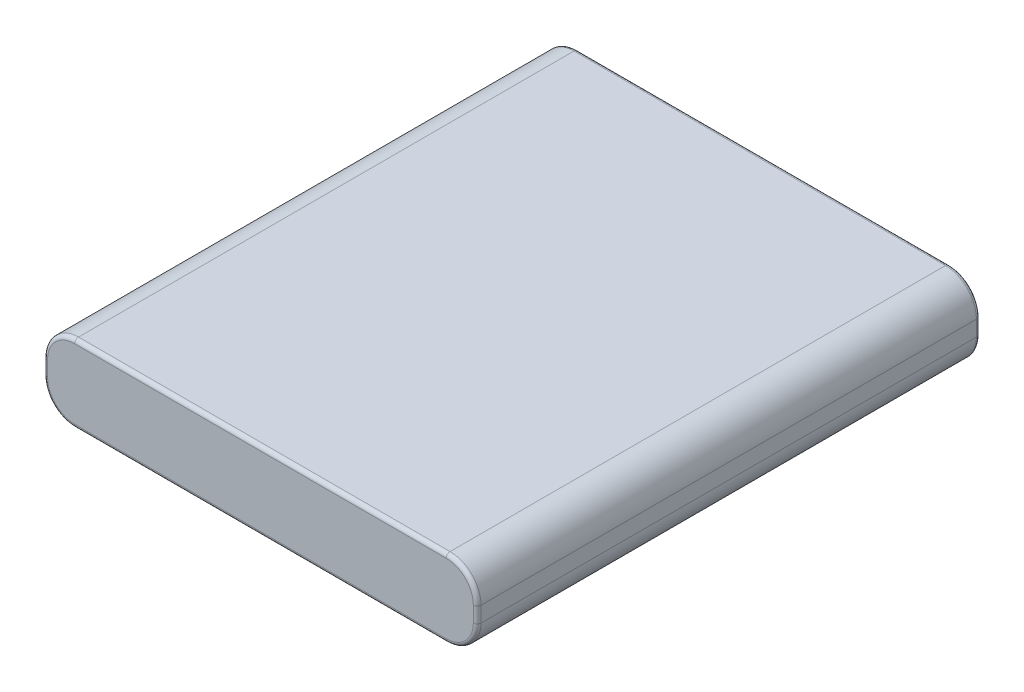
from build123d import *

# Parameters (mm, degrees)
SKETCH_1_W      = 56
SKETCH_1_H      = 65
EXTRUDE_1_DEPTH = 10
FILLET_1_R      = 4
FILLET_2_R      = 0.5
SKETCH_2_R      = 7
EXTRUDE_2_DEPTH = 2


with BuildPart() as part:
    # 草图1 → 凸台-拉伸1 (new body)
    with BuildSketch(Plane(origin=(0, 0, 0), x_dir=(1, 0, 0), z_dir=(0, 1, 0))):
        Rectangle(SKETCH_1_W, SKETCH_1_H)
    extrude(amount=EXTRUDE_1_DEPTH)

    # 圆角1
    fillet_1_edges = [part.edges().sort_by_distance(p)[0] for p in [
        (-28, 0, 0),
        (28, 0, 0),
        (28, 10, 0),
        (-28, 10, 0),
    ]]
    fillet(fillet_1_edges, radius=FILLET_1_R)

    # 圆角2
    fillet_2_edges = [part.edges().sort_by_distance(p)[0] for p in [
        (26.828427125, 1.171572875, -32.5),
        (28, 5, -32.5),
        (26.828427125, 8.828427125, -32.5),
        (0, 10, -32.5),
        (-26.828427125, 8.828427125, -32.5),
        (-28, 5, -32.5),
        (-26.828427125, 1.171572875, -32.5),
        (0, 0, -32.5),
        (-26.828427125, 8.828427125, 32.5),
        (0, 10, 32.5),
        (26.828427125, 8.828427125, 32.5),
        (28, 5, 32.5),
        (26.828427125, 1.171572875, 32.5),
        (0, 0, 32.5),
        (-26.828427125, 1.171572875, 32.5),
        (-28, 5, 32.5),
    ]]
    fillet(fillet_2_edges, radius=FILLET_2_R)

    # 草图2 → 凸台-拉伸2 (add)
    with BuildSketch(Plane.XZ):
        with Locations((0, 6.105786748)):
            Circle(SKETCH_2_R)
    extrude(amount=EXTRUDE_2_DEPTH)


solid = part.part
